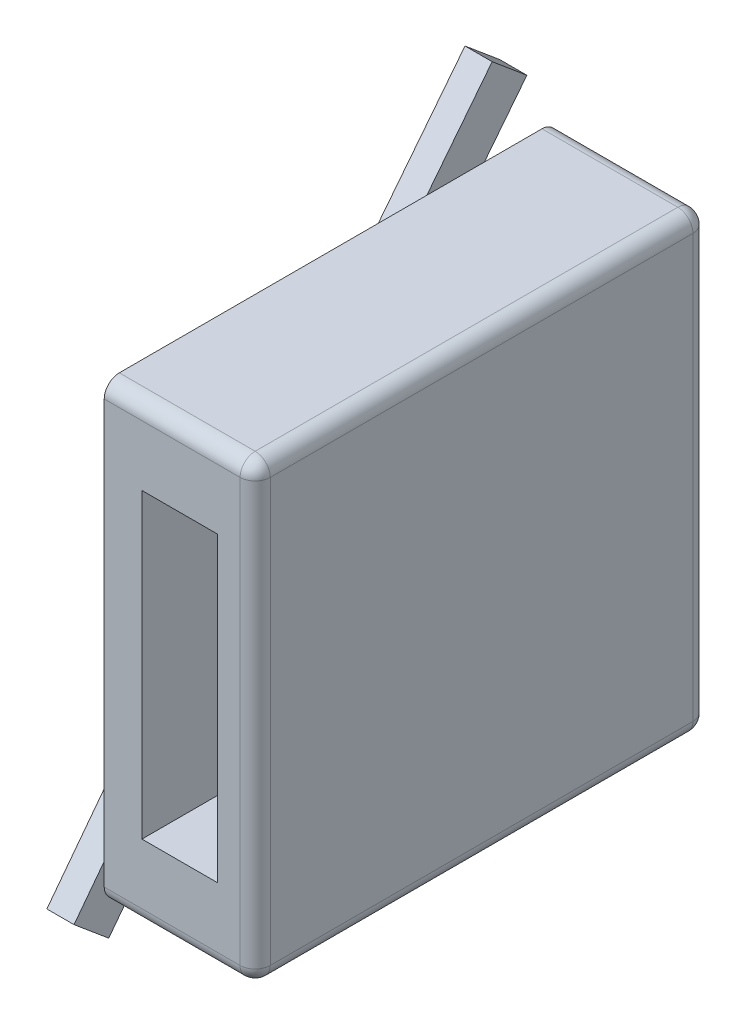
from build123d import *
from build123d.topology import SkipClean

# Parameters (mm, degrees)
SKETCH_2_R          = 2
EXTRUDE_1_DEPTH     = 6
EXTRUDE_2_DEPTH     = 1.8
SKETCH_6_W          = 30
SKETCH_6_H          = 30
EXTRUDE_3_DEPTH     = 10
SKETCH_7_W          = 5
SKETCH_7_H          = 20
CUT_EXTRUDE_1_DEPTH = 37.936034472
FILLET_1_R          = 1


with BuildPart() as part:
    # Эскиз2 → Бобышка-Вытянуть1 (new body)
    with BuildSketch(Plane(origin=(0, 0, 0), x_dir=(0, 0, -1), z_dir=(1, 0, 0))):
        Circle(SKETCH_2_R)
    extrude(amount=-EXTRUDE_1_DEPTH)

    # Эскиз5 → Бобышка-Вытянуть2 (add)
    with SkipClean():  # the faces are left unmerged after this step: merging them gives an invalid solid
        with BuildSketch(Plane(origin=(-2, 0, 0), x_dir=(0, 0, -1), z_dir=(1, 0, 0))):
            with BuildLine():
                Line((12.700200279, 18.5), (-0.300448261, 1.977303933))
                ThreePointArc((-0.300448261, 1.977303933), (-1.533199814, 1.284250104), (-1.99935146, -0.050928777))
                Line((-1.99935146, -0.050928777), (-15, -17.159500316))
                Line((-15, -17.159500316), (-12.700200279, -19.085875472))
                Line((-12.700200279, -19.085875472), (0.300448261, -1.977303933))
                ThreePointArc((0.300448261, -1.977303933), (1.533199814, -1.284250104), (1.99935146, 0.050928777))
                Line((1.99935146, 0.050928777), (15, 16.573624844))
                Line((15, 16.573624844), (12.700200279, 18.5))
            make_face()
        extrude(amount=-EXTRUDE_2_DEPTH)

    # Эскиз6 → Бобышка-Вытянуть3 (add)
    with BuildSketch(Plane(origin=(0, 0, 0), x_dir=(0, 0, -1), z_dir=(1, 0, 0))):
        Rectangle(SKETCH_6_W, SKETCH_6_H)
    extrude(amount=EXTRUDE_3_DEPTH)

    # Эскиз7 → Вырез-Вытянуть1 (cut, through all)
    with BuildSketch(Plane.XY.offset(15)):
        with Locations((5, 0)):
            Rectangle(SKETCH_7_W, SKETCH_7_H)
    extrude(amount=-CUT_EXTRUDE_1_DEPTH, mode=Mode.SUBTRACT)

    # Скругление1
    fillet_1_edges = [part.edges().sort_by_distance(p)[0] for p in [
        (5, 15, 15),
        (5, 15, -15),
        (10, -15, 0),
        (5, -15, -15),
        (5, -15, 15),
        (10, 0, -15),
        (10, 0, 15),
        (10, 15, 0),
    ]]
    fillet(fillet_1_edges, radius=FILLET_1_R)


solid = part.part
